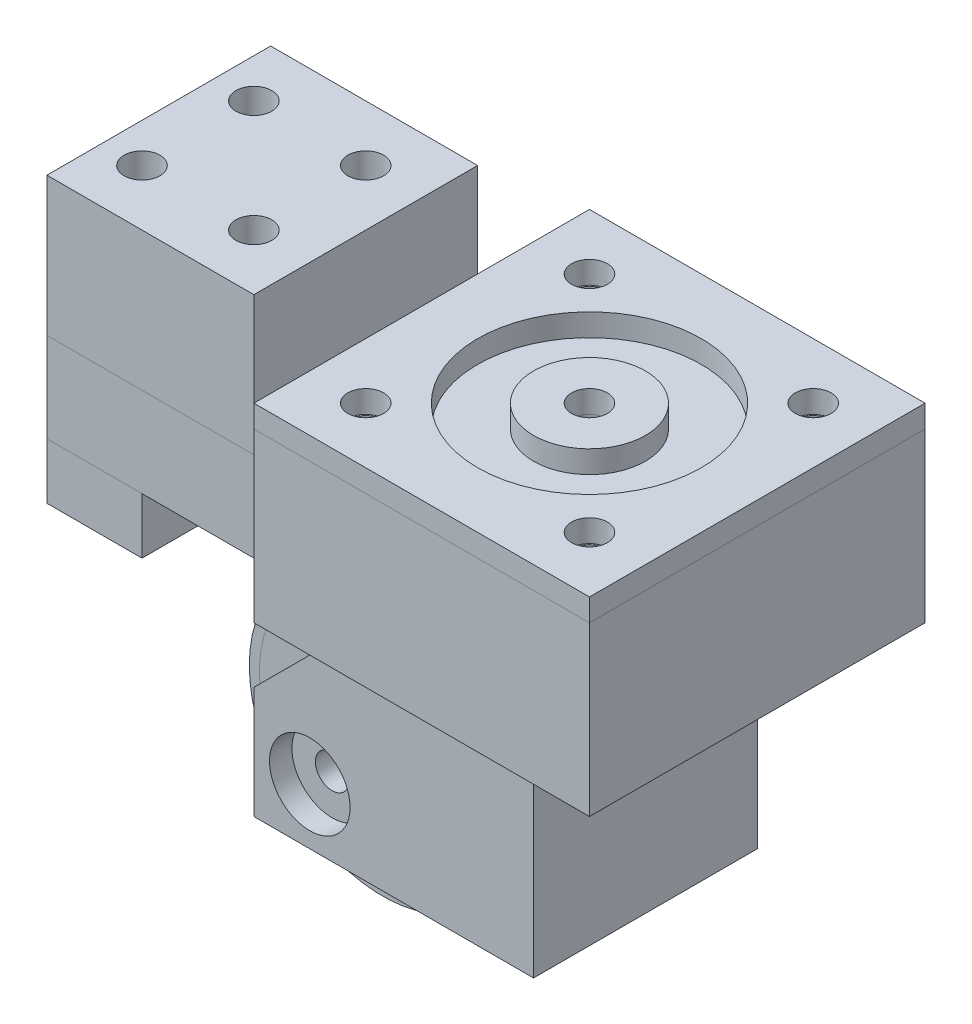
from build123d import *

# Parameters (mm, degrees)
BOSS_EXTRUDE1_START       = 1
SKETCH1_R                 = 11
SKETCH1_R_2               = 4
BOSS_EXTRUDE1_DEPTH       = 14
SKETCH2_W                 = 30
SKETCH2_H                 = 30
SKETCH2_R                 = 11.1
BOSS_EXTRUDE2_DEPTH       = 15
SKETCH22_R                = 11.1
SKETCH22_R_2              = 10
BOSS_EXTRUDE14_DEPTH      = 1
SKETCH23_W                = 30
SKETCH23_H                = 30
SKETCH23_R                = 10
BOSS_EXTRUDE15_DEPTH      = 2
SKETCH24_R                = 1.475
CUT_EXTRUDE7_DEPTH        = 20
SKETCH25_R                = 1.6
CUT_EXTRUDE8_DEPTH        = 28.184554438
CIRPATTERN1_OUTLINE_R     = 1.475
CIRPATTERN1_DEPTH         = 17
CIRPATTERN1_START         = 15
CIRPATTERN1_2_OUTLINE_R   = 1.6
CIRPATTERN1_2_OUTLINE_R_2 = 1.475
CIRPATTERN1_2_DEPTH       = 2
SKETCH4_W                 = 35
SKETCH4_H                 = 20
BOSS_EXTRUDE4_DEPTH       = 8
SKETCH28_W                = 20
SKETCH28_H                = 20
BOSS_EXTRUDE16_DEPTH      = 5
SKETCH19_R                = 1.475
CUT_EXTRUDE5_DEPTH        = 54.795910625
SKETCH30_R                = 1.6
CUT_EXTRUDE11_DEPTH       = 5
LPATTERN1_COUNT           = 3
LPATTERN1_PITCH           = 10
LPATTERN1_COUNT_DIR2      = 2
LPATTERN1_PITCH_DIR2      = 10
LPATTERN2_COUNT           = 2
LPATTERN2_PITCH           = 10
LPATTERN2_COUNT_DIR2      = 2
LPATTERN2_PITCH_DIR2      = 10
CHAMFER4_SIZE             = 5
CHAMFER5_SIZE2            = 5
CHAMFER5_SIZE             = 7
BOSS_EXTRUDE8_START       = 1
SKETCH9_R                 = 4
SKETCH9_R_2               = 1.6
BOSS_EXTRUDE8_DEPTH       = 14
BOSS_EXTRUDE5_DEPTH       = 3.5
BOSS_EXTRUDE5_DEPTH_BACK  = 3.5
SKETCH5_R                 = 11
SKETCH5_R_2               = 4
SKETCH6_R                 = 13
SKETCH6_R_2               = 10.9
BOSS_EXTRUDE6_DEPTH       = 7
CHAMFER1_SIZE             = 3
CHAMFER1_SIZE2            = 1.091910703
SKETCH7_R                 = 4
SKETCH7_R_2               = 1.6
BOSS_EXTRUDE7_DEPTH       = 3.5
BOSS_EXTRUDE9_START       = 5
SKETCH10_W                = 25
SKETCH10_H                = 10
SKETCH10_R                = 1.5
BOSS_EXTRUDE9_DEPTH       = 5
SKETCH12_R                = 5
SKETCH12_R_2              = 1.6
BOSS_EXTRUDE10_DEPTH      = 1.5
BOSS_EXTRUDE11_DEPTH      = 5
BOSS_EXTRUDE11_DEPTH_BACK = 5
SKETCH13_W                = 10
SKETCH13_H                = 18.5
CHAMFER2_SIZE             = 15
SKETCH14_R                = 14
CUT_EXTRUDE1_DEPTH        = 5
SKETCH16_R                = 1.475
CUT_EXTRUDE2_DEPTH        = 59.542719445
SKETCH15_R                = 5
SKETCH15_R_2              = 1.6
BOSS_EXTRUDE12_DEPTH      = 2.5
SKETCH17_R                = 3.6
CUT_EXTRUDE3_DEPTH        = 2
CUT_EXTRUDE4_DEPTH        = 2
SKETCH21_R                = 5
SKETCH21_R_2              = 1.6
BOSS_EXTRUDE13_DEPTH      = 2
SKETCH29_W                = 10
SKETCH29_H                = 20
CUT_EXTRUDE10_DEPTH       = 64.41135545
SKETCH31_W                = 1.5
SKETCH31_H                = 20
CUT_EXTRUDE12_DEPTH       = 61.613529843
BOSS_EXTRUDE17_DEPTH      = 5.4
BOSS_EXTRUDE17_DEPTH_BACK = 7
SKETCH32_W                = 18.5
SKETCH32_H                = 20
SKETCH32_R                = 1.6


# Read off the part's stored shape, not the designer's step: CirPattern1
# Some blends are built 0.0001 mm under size
with BuildPart() as part:
    # Sketch1 → Boss-Extrude1 (new body)
    with BuildSketch(Plane(origin=(0, 0, 0), x_dir=(1, 0, 0), z_dir=(0, 1, 0)).offset(BOSS_EXTRUDE1_START)):
        with Locations(Location((0, 0, 0), (0, 0, 270))):
            Circle(SKETCH1_R)
        with Locations(Location((0, 0, 0), (0, 0, 270))):
            Circle(SKETCH1_R_2, mode=Mode.SUBTRACT)
    extrude(amount=BOSS_EXTRUDE1_DEPTH)


with BuildPart() as body_2:
    # Sketch2 → Boss-Extrude2 (new body)
    with BuildSketch(Plane(origin=(0, 0, 0), x_dir=(1, 0, 0), z_dir=(0, 1, 0))):
        Rectangle(SKETCH2_W, SKETCH2_H)
        with Locations(Location((0, 0, 0), (0, 0, 90))):
            Circle(SKETCH2_R, mode=Mode.SUBTRACT)
    extrude(amount=BOSS_EXTRUDE2_DEPTH)

    # Sketch22 → Boss-Extrude14 (add)
    with BuildSketch(Plane(origin=(0, 0, 0), x_dir=(1, 0, 0), z_dir=(0, 1, 0))):
        with Locations(Location((0, 0, 0), (0, 0, 90))):
            Circle(SKETCH22_R)
        with Locations(Location((0, 0, 0), (0, 0, 270))):
            Circle(SKETCH22_R_2, mode=Mode.SUBTRACT)
    extrude(amount=BOSS_EXTRUDE14_DEPTH)


with BuildPart() as body_3:
    # Sketch23 → Boss-Extrude15 (new body)
    with BuildSketch(Plane(origin=(0, 15, 0), x_dir=(1, 0, 0), z_dir=(0, 1, 0))):
        Rectangle(SKETCH23_W, SKETCH23_H)
        with Locations(Location((0, 0, 0), (0, 0, 270))):
            Circle(SKETCH23_R, mode=Mode.SUBTRACT)
    extrude(amount=BOSS_EXTRUDE15_DEPTH)


with BuildPart() as cut_extrude7_tool:
    # Sketch24 → Cut-Extrude7 (new body)
    with BuildSketch(Plane(origin=(0, 17, 0), x_dir=(1, 0, 0), z_dir=(0, 1, 0))):
        with Locations(Location((-10, 10, 0), (0, 0, 270))):
            Circle(SKETCH24_R)
    extrude(amount=-CUT_EXTRUDE7_DEPTH)


with BuildPart() as body_2_1:
    add(body_2.part)

    # Cut-Extrude7: cut by cut_extrude7_tool
    add(cut_extrude7_tool.part, mode=Mode.SUBTRACT)


with BuildPart() as body_3_1:
    add(body_3.part)

    # Cut-Extrude7: cut by cut_extrude7_tool
    add(cut_extrude7_tool.part, mode=Mode.SUBTRACT)

    # Sketch25 → Cut-Extrude8 (cut, through all)
    with BuildSketch(Plane(origin=(0, 17, 0), x_dir=(1, 0, 0), z_dir=(0, 1, 0))):
        with Locations(Location((-10, 10, 0), (0, 0, 270))):
            Circle(SKETCH25_R)
    extrude(amount=-CUT_EXTRUDE8_DEPTH, mode=Mode.SUBTRACT)


with BuildPart() as cirpattern1_tool:
    # CirPattern1 outline → CirPattern1 (new body)
    with BuildSketch(Plane(origin=(0, 0, 0), x_dir=(1, 0, 0), z_dir=(0, 1, 0))):
        with Locations((-10, -10)):
            Circle(CIRPATTERN1_OUTLINE_R)
        with Locations((10, -10)):
            Circle(CIRPATTERN1_OUTLINE_R)
        with Locations((10, 10)):
            Circle(CIRPATTERN1_OUTLINE_R)
    extrude(amount=CIRPATTERN1_DEPTH)


with BuildPart() as body_2_2:
    add(body_2_1.part)

    # CirPattern1: cut by cirpattern1_tool
    add(cirpattern1_tool.part, mode=Mode.SUBTRACT)

    # Sketch4 → Boss-Extrude4 (add)
    with BuildSketch(Plane(origin=(0, 0, 0), x_dir=(1, 0, 0), z_dir=(0, 1, 0))):
        with Locations((-32.5, 0)):
            Rectangle(SKETCH4_W, SKETCH4_H)
    extrude(amount=BOSS_EXTRUDE4_DEPTH)


with BuildPart() as body_3_2:
    add(body_3_1.part)

    # CirPattern1: cut by cirpattern1_tool
    add(cirpattern1_tool.part, mode=Mode.SUBTRACT)

    # CirPattern1 2 outline → CirPattern1 2 (cut)
    # profile 1 of 3: a face of its own
    with BuildSketch(Plane(origin=(0, 0, 0), x_dir=(1, 0, 0), z_dir=(0, 1, 0)).offset(CIRPATTERN1_START)):
        with Locations((-10, -10)):
            Circle(CIRPATTERN1_2_OUTLINE_R)
        with Locations((-10, -10)):
            Circle(CIRPATTERN1_2_OUTLINE_R_2, mode=Mode.SUBTRACT)
    # profile 2 of 3: a face of its own
    with BuildSketch(Plane(origin=(0, 0, 0), x_dir=(1, 0, 0), z_dir=(0, 1, 0)).offset(CIRPATTERN1_START)):
        with Locations((10, -10)):
            Circle(CIRPATTERN1_2_OUTLINE_R)
        with Locations((10, -10)):
            Circle(CIRPATTERN1_2_OUTLINE_R_2, mode=Mode.SUBTRACT)
    # profile 3 of 3: a face of its own
    with BuildSketch(Plane(origin=(0, 0, 0), x_dir=(1, 0, 0), z_dir=(0, 1, 0)).offset(CIRPATTERN1_START)):
        with Locations((10, 10)):
            Circle(CIRPATTERN1_2_OUTLINE_R)
        with Locations((10, 10)):
            Circle(CIRPATTERN1_2_OUTLINE_R_2, mode=Mode.SUBTRACT)
    extrude(amount=CIRPATTERN1_2_DEPTH, mode=Mode.SUBTRACT)


with BuildPart() as body_4:
    # Sketch28 → Boss-Extrude16 (new body)
    with BuildSketch(Plane.XZ):
        with Locations((-40, 0)):
            Rectangle(SKETCH28_W, SKETCH28_H)
    extrude(amount=BOSS_EXTRUDE16_DEPTH)


with BuildPart() as cut_extrude5_tool:
    # Sketch19 → Cut-Extrude5 (new, through all)
    with BuildSketch(Plane(origin=(0, 8, 0), x_dir=(1, 0, 0), z_dir=(0, 1, 0))):
        with Locations(Location((-45, 5, 0), (0, 0, 270))):
            Circle(SKETCH19_R)
    cut_extrude5 = extrude(amount=-CUT_EXTRUDE5_DEPTH)


with BuildPart() as body_2_3:
    add(body_2_2.part)

    # Cut-Extrude5: cut by cut_extrude5_tool
    add(cut_extrude5_tool.part, mode=Mode.SUBTRACT)


with BuildPart() as body_4_1:
    add(body_4.part)

    # Cut-Extrude5: cut by cut_extrude5_tool
    add(cut_extrude5_tool.part, mode=Mode.SUBTRACT)

    # Sketch30 → Cut-Extrude11 (cut)
    with BuildSketch(Plane.XZ.offset(5)):
        with Locations(Location((-45, -5, 0), (0, 0, 270))):
            Circle(SKETCH30_R)
    cut_extrude11 = extrude(amount=-CUT_EXTRUDE11_DEPTH, mode=Mode.SUBTRACT)


with BuildPart() as lpattern1_tool:
    # LPattern1: Cut-Extrude5 3 × 2
    with Locations(*[(i * LPATTERN1_PITCH, 0, j * LPATTERN1_PITCH_DIR2) for i in range(LPATTERN1_COUNT) for j in range(LPATTERN1_COUNT_DIR2) if (i, j) != (0, 0)]):
        add(cut_extrude5)


with BuildPart() as body_2_4:
    add(body_2_3.part)

    # LPattern1: cut by lpattern1_tool
    add(lpattern1_tool.part, mode=Mode.SUBTRACT)

    # Chamfer4
    chamfer4_edges = [body_2_4.edges().sort_by_distance(p)[0] for p in [
        (-15, 4, -10),
        (-15, 4, 10),
    ]]
    chamfer(chamfer4_edges, length=CHAMFER4_SIZE - 0.0001)  # a hair under: the kernel refuses the full size

    # Chamfer5
    chamfer5_edges = [body_2_4.edges().sort_by_distance(p)[0] for p in [
        (-15, 8, 0),
    ]]
    chamfer5_side = [body_2_4.faces().sort_by_distance(p)[0] for p in [
        (-15, 8.1, 0),
    ]]
    chamfer(chamfer5_edges, length=CHAMFER5_SIZE - 0.0001, length2=CHAMFER5_SIZE2 - 0.0001, reference=chamfer5_side[0])  # a hair under: the kernel refuses the full size


with BuildPart() as body_4_2:
    add(body_4_1.part)

    # LPattern1: cut by lpattern1_tool
    add(lpattern1_tool.part, mode=Mode.SUBTRACT)

    # LPattern2: Cut-Extrude11 2 × 2
    with Locations(*[(i * LPATTERN2_PITCH, 0, j * LPATTERN2_PITCH_DIR2) for i in range(LPATTERN2_COUNT) for j in range(LPATTERN2_COUNT_DIR2) if (i, j) != (0, 0)]):
        add(cut_extrude11, mode=Mode.SUBTRACT)


with BuildPart() as body_5:
    # Sketch9 → Boss-Extrude8 (new body)
    with BuildSketch(Plane(origin=(0, 0, 0), x_dir=(1, 0, 0), z_dir=(0, 1, 0)).offset(BOSS_EXTRUDE8_START)):
        with Locations(Location((0, 0, 0), (0, 0, 270))):
            Circle(SKETCH9_R)
        with Locations(Location((0, 0, 0), (0, 0, 270))):
            Circle(SKETCH9_R_2, mode=Mode.SUBTRACT)
    extrude(amount=BOSS_EXTRUDE8_DEPTH)


with BuildPart() as body_6:
    # Sketch5 → Boss-Extrude5 (new, two sides: drawn at the far end of the back side and taken through both)
    with BuildSketch(Plane.XY.offset(-BOSS_EXTRUDE5_DEPTH_BACK)):
        with Locations((-15, -15)):
            Circle(SKETCH5_R)
        with Locations((-15, -15)):
            Circle(SKETCH5_R_2, mode=Mode.SUBTRACT)
    extrude(amount=BOSS_EXTRUDE5_DEPTH + BOSS_EXTRUDE5_DEPTH_BACK)


with BuildPart() as body_7:
    # Sketch6 → Boss-Extrude6 (new body)
    with BuildSketch(Plane.XY.offset(3.5)):
        with Locations((-15, -15)):
            Circle(SKETCH6_R)
        with Locations((-15, -15)):
            Circle(SKETCH6_R_2, mode=Mode.SUBTRACT)
    extrude(amount=-BOSS_EXTRUDE6_DEPTH)

    # Chamfer1
    chamfer1_edges = [body_7.edges().sort_by_distance(p)[0] for p in [
        (-28, -15, 3.5),
        (-28, -15, -3.5),
    ]]
    chamfer1_side = [body_7.faces().sort_by_distance(p)[0] for p in [
        (-28, -15, 0),
    ]]
    chamfer(chamfer1_edges, length=CHAMFER1_SIZE, length2=CHAMFER1_SIZE2, reference=chamfer1_side[0])


with BuildPart() as body_8:
    # Sketch7 → Boss-Extrude7 (new body)
    with BuildSketch(Plane.XY.offset(3.5)):
        with Locations((-15, -15)):
            Circle(SKETCH7_R)
        with Locations((-15, -15)):
            Circle(SKETCH7_R_2, mode=Mode.SUBTRACT)
    extrude(amount=-BOSS_EXTRUDE7_DEPTH)

    # Sketch12 → Boss-Extrude10 (add)
    with BuildSketch(Plane.XY.offset(3.5)):
        with Locations((-15, -15)):
            Circle(SKETCH12_R)
        with Locations((-15, -15)):
            Circle(SKETCH12_R_2, mode=Mode.SUBTRACT)
    extrude(amount=BOSS_EXTRUDE10_DEPTH)


with BuildPart() as body_9:
    # Sketch10 → Boss-Extrude9 (new body)
    with BuildSketch(Plane.XY.offset(BOSS_EXTRUDE9_START)):
        with Locations((-7.5, -15)):
            Rectangle(SKETCH10_W, SKETCH10_H)
        with Locations((-15, -15)):
            Circle(SKETCH10_R, mode=Mode.SUBTRACT)
    extrude(amount=BOSS_EXTRUDE9_DEPTH)

    # Sketch13 → Boss-Extrude11 (add, two sides: drawn at the far end of the back side and taken through both)
    with BuildSketch(Plane(origin=(0, 0, 5), x_dir=(-1, 0, 0), z_dir=(0, 0, -1)).offset(-BOSS_EXTRUDE11_DEPTH_BACK)):
        with Locations((0, -10.75)):
            Rectangle(SKETCH13_W, SKETCH13_H)
    extrude(amount=BOSS_EXTRUDE11_DEPTH + BOSS_EXTRUDE11_DEPTH_BACK)

    # Chamfer2
    # the kernel refuses this chamfer: 15 mm, written as the material it adds along each edge
    with BuildSketch(Plane(origin=(-5, -10, 10), x_dir=(-0.9996219169112968, -0.02749587661058632, 0), z_dir=(0, 0, -1))) as chamfer2_piece_1_section:
        Polygon((CHAMFER2_SIZE * 0.999621916911, CHAMFER2_SIZE * 0.0274958766106), (-CHAMFER2_SIZE * 0.0274958766106, CHAMFER2_SIZE * 0.999621916911), (0, 0), align=None)
    chamfer2_piece_1 = extrude(amount=5, mode=Mode.PRIVATE)
    chamfer2_piece_1 = split(chamfer2_piece_1, bisect_by=Plane(origin=(-20, -6.510199525, 7.5), z_dir=(1, 0, 0)), keep=Keep.TOP, mode=Mode.PRIVATE)
    chamfer2_piece_1 = split(chamfer2_piece_1, bisect_by=Plane(origin=(-10.693374649, -1.5, 7.5), z_dir=(0, -1, 0)), keep=Keep.TOP, mode=Mode.PRIVATE)
    add(chamfer2_piece_1)

    # Sketch14 → Cut-Extrude1 (cut)
    with BuildSketch(Plane(origin=(0, 0, 0), x_dir=(-1, 0, 0), z_dir=(0, 0, -1))):
        with Locations((15, -15)):
            Circle(SKETCH14_R)
    extrude(amount=-CUT_EXTRUDE1_DEPTH, mode=Mode.SUBTRACT)

    # Mirror1: body 9 across plane


with BuildPart() as body_9_1:
    add(body_9.part)
    add(body_9.part.mirror(Plane.XY))

    # Sketch16 → Cut-Extrude2 (cut, through all)
    with BuildSketch(Plane(origin=(0, -1.5, 0), x_dir=(1, 0, 0), z_dir=(0, 1, 0))):
        with Locations(Location((0, 0, 0), (0, 0, 180))):
            Circle(SKETCH16_R)
    extrude(amount=-CUT_EXTRUDE2_DEPTH, mode=Mode.SUBTRACT)

    # Sketch17 → Cut-Extrude3 (cut)
    with BuildSketch(Plane.XY.offset(10)):
        with Locations((-15, -15)):
            Circle(SKETCH17_R)
    extrude(amount=-CUT_EXTRUDE3_DEPTH, mode=Mode.SUBTRACT)

    # Sketch18 → Cut-Extrude4 (cut)
    with BuildSketch(Plane(origin=(0, 0, -10), x_dir=(-1, 0, 0), z_dir=(0, 0, -1))):
        Polygon((12.2, -16.616580754), (15, -18.233161507), (17.8, -16.616580754), (17.8, -13.383419246), (15, -11.766838493), (12.2, -13.383419246), align=None)
    extrude(amount=-CUT_EXTRUDE4_DEPTH, mode=Mode.SUBTRACT)


with BuildPart() as body_10:
    # Mirror2: mirrored copy
    add(body_8.part.mirror(Plane.XY))


with BuildPart() as body_11:
    # Sketch15 → Boss-Extrude12 (new body)
    with BuildSketch(Plane.XZ.offset(-1)):
        with Locations(Location((0, 0, 0), (0, 0, 90))):
            Circle(SKETCH15_R)
        with Locations(Location((0, 0, 0), (0, 0, 90))):
            Circle(SKETCH15_R_2, mode=Mode.SUBTRACT)
    extrude(amount=BOSS_EXTRUDE12_DEPTH)


with BuildPart() as body_9_2:
    add(body_9_1.part)

    # Combine1: union body 11, body 5
    add(body_11.part)
    add(body_5.part)


with BuildPart() as body_10_2:
    # Sketch21 → Boss-Extrude13 (new body)
    with BuildSketch(Plane(origin=(0, 15, 0), x_dir=(1, 0, 0), z_dir=(0, 1, 0))):
        with Locations(Location((0, 0, 0), (0, 0, 270))):
            Circle(SKETCH21_R)
        with Locations(Location((0, 0, 0), (0, 0, 270))):
            Circle(SKETCH21_R_2, mode=Mode.SUBTRACT)
    extrude(amount=BOSS_EXTRUDE13_DEPTH)


with BuildPart() as cut_extrude10_tool:
    # Sketch29 → Cut-Extrude10 (new, through all)
    with BuildSketch(Plane(origin=(0, 8, 0), x_dir=(1, 0, 0), z_dir=(0, 1, 0))):
        with Locations((-45, 0)):
            Rectangle(SKETCH29_W, SKETCH29_H)
    extrude(amount=-CUT_EXTRUDE10_DEPTH)


with BuildPart() as body_2_5:
    add(body_2_4.part)

    # Cut-Extrude10: cut by cut_extrude10_tool
    add(cut_extrude10_tool.part, mode=Mode.SUBTRACT)


with BuildPart() as body_4_3:
    add(body_4_2.part)

    # Cut-Extrude10: cut by cut_extrude10_tool
    add(cut_extrude10_tool.part, mode=Mode.SUBTRACT)


with BuildPart() as cut_extrude12_tool:
    # Sketch31 → Cut-Extrude12 (new, through all)
    with BuildSketch(Plane(origin=(0, 15, 0), x_dir=(1, 0, 0), z_dir=(0, 1, 0))):
        with Locations((-39.25, 0)):
            Rectangle(SKETCH31_W, SKETCH31_H)
    extrude(amount=-CUT_EXTRUDE12_DEPTH)


with BuildPart() as body_2_6:
    add(body_2_5.part)

    # Cut-Extrude12: cut by cut_extrude12_tool
    add(cut_extrude12_tool.part, mode=Mode.SUBTRACT)


with BuildPart() as body_4_4:
    add(body_4_3.part)

    # Cut-Extrude12: cut by cut_extrude12_tool
    add(cut_extrude12_tool.part, mode=Mode.SUBTRACT)


with BuildPart() as body_11_2:
    # Sketch32 → Boss-Extrude17 (new, two sides: drawn at the far end of the back side and taken through both)
    with BuildSketch(Plane(origin=(0, 15, 0), x_dir=(1, 0, 0), z_dir=(0, 1, 0)).offset(-BOSS_EXTRUDE17_DEPTH_BACK)):
        with Locations((-29.25, 0)):
            Rectangle(SKETCH32_W, SKETCH32_H)
        with Locations(Location((-35, 5, 0), (0, 0, 270))):
            Circle(SKETCH32_R, mode=Mode.SUBTRACT)
        with Locations(Location((-25, -5, 0), (0, 0, 270))):
            Circle(SKETCH32_R, mode=Mode.SUBTRACT)
        with Locations(Location((-25, 5, 0), (0, 0, 270))):
            Circle(SKETCH32_R, mode=Mode.SUBTRACT)
        with Locations(Location((-35, -5, 0), (0, 0, 270))):
            Circle(SKETCH32_R, mode=Mode.SUBTRACT)
    extrude(amount=BOSS_EXTRUDE17_DEPTH + BOSS_EXTRUDE17_DEPTH_BACK)


solid = Compound([part.part, body_3_2.part, body_6.part, body_7.part, body_8.part, body_10.part, body_9_2.part, body_10_2.part, body_2_6.part, body_4_4.part, body_11_2.part])
